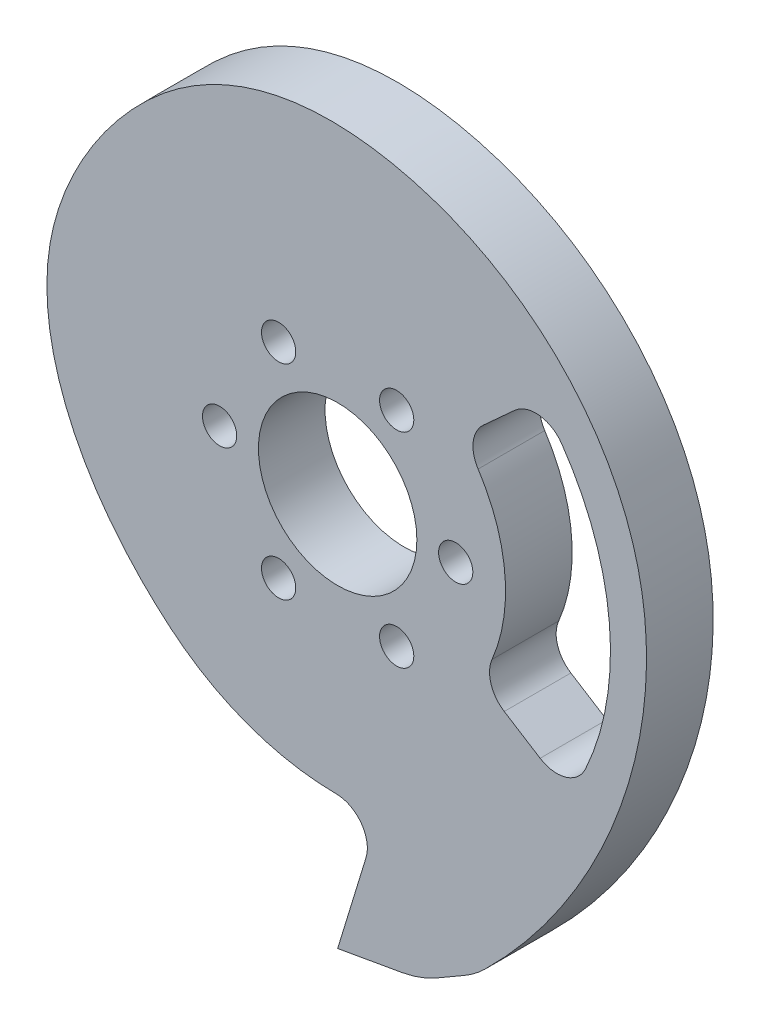
from build123d import *
from OCP.BRepFilletAPI import BRepFilletAPI_MakeFillet

# Parameters (mm, degrees)
SKETCH1_R                   = 15.1
BOSS_EXTRUDE1_DEPTH         = 12.7
FILLET1_R1                  = 6
FILLET1_R2                  = 20
CUT_EXTRUDE1_DEPTH          = 97.187316036
FILLET2_R                   = 6
F_1_4_CLEARANCE_HOLE1_D     = 6.5278
F_1_4_CLEARANCE_HOLE1_DEPTH = 54.11
F_1_4_CLEARANCE_HOLE1_TIP   = 1.961148974


with BuildPart() as part:
    # Sketch1 → Boss-Extrude1 (new body)
    with BuildSketch(Plane.XY):
        with BuildLine():
            ThreePointArc((-31.88226544, -37.995804379), (-13.155899314, -47.823449407), (7.962221644, -48.956746486))
            Line((7.962221644, -48.956746486), (0, -75))
            Line((0, -75), (15.756924048, -72.221629157))
            Line((15.756924048, -72.221629157), (26.149228894, -66.221629157))
            add(Edge.make_bspline(
                [(26.149228894, -66.221629157), (51.375242172, -42.5711118), (73.155327324, 16.265957691), (24.786084456, 64.170295229), (-29.726149903, 61.426673461), (-65.053373901, 8.823513537), (-48.308937171, -24.212190188), (-31.88226544, -37.995804379)],
                knots=[0, 0, 0, 0, 0.320521396, 0.565793749, 0.734822836, 0.843782163, 1, 1, 1, 1], degree=3))
        make_face()
        Circle(SKETCH1_R, mode=Mode.SUBTRACT)
    extrude(amount=BOSS_EXTRUDE1_DEPTH)

    # Fillet1: one fillet with a radius per group of edges: ONE call of the kernel's fillet builder (fillet() takes one radius for all edges)
    fillet1_edges_1 = [part.edges().sort_by_distance(p)[0] for p in [
        (7.962221644, -48.956746486, 6.35),
    ]]
    fillet1_edges_2 = [part.edges().sort_by_distance(p)[0] for p in [
        (15.756924048, -72.221629157, 6.35),
        (26.149228894, -66.221629157, 6.35),
    ]]
    fillet1 = BRepFilletAPI_MakeFillet(part.part.solid().wrapped)
    for e in fillet1_edges_1:
        fillet1.Add(FILLET1_R1, e.wrapped)
    for e in fillet1_edges_2:
        fillet1.Add(FILLET1_R2, e.wrapped)
    add(Compound.cast(fillet1.Shape()), mode=Mode.REPLACE)

    # Sketch2 → Cut-Extrude1 (cut, through all)
    with BuildSketch(Plane.XY.offset(12.7)):
        with BuildLine():
            Line((38.459406213, 34.998201007), (23.6673269, 21.537354466))
            ThreePointArc((23.6673269, 21.537354466), (31.875670784, 2.818086599), (27.078868652, -17.050949314))
            Line((27.078868652, -17.050949314), (44.00316156, -27.707792636))
            ThreePointArc((44.00316156, -27.707792636), (51.797965024, 4.579390723), (38.459406213, 34.998201007))
        make_face()
    extrude(amount=-CUT_EXTRUDE1_DEPTH, mode=Mode.SUBTRACT)

    # Fillet2
    fillet2_edges = [part.edges().sort_by_distance(p)[0] for p in [
        (27.078868652, -17.050949314, 6.35),
        (38.459406213, 34.998201007, 6.35),
        (44.00316156, -27.707792636, 6.35),
        (23.6673269, 21.537354466, 6.35),
    ]]
    fillet(fillet2_edges, radius=FILLET2_R)

    # 1/4 Clearance Hole1
    with Locations(Plane.XY.offset(12.7)):
        with Locations((22.5, 0), (11.25, -19.485571585), (-11.25, -19.485571585), (-22.5, 0), (-11.25, 19.485571585), (11.25, 19.485571585)):
            Hole(F_1_4_CLEARANCE_HOLE1_D / 2, depth=F_1_4_CLEARANCE_HOLE1_DEPTH)
            with Locations((0, 0, -(F_1_4_CLEARANCE_HOLE1_DEPTH + F_1_4_CLEARANCE_HOLE1_TIP / 2))):  # 118° drill point
                Cone(0, F_1_4_CLEARANCE_HOLE1_D / 2, F_1_4_CLEARANCE_HOLE1_TIP, mode=Mode.SUBTRACT)


solid = part.part
